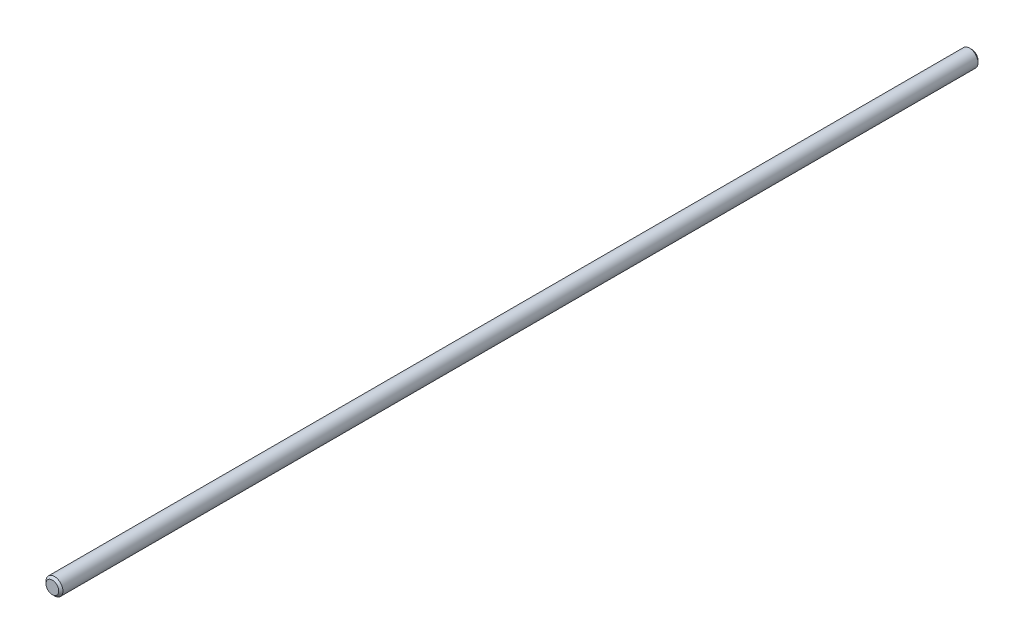
from build123d import *

# Parameters (mm, degrees)
SCHIZZO1_R                   = 4
ESTRUSIONE_ESTRUSIONE1_DEPTH = 435
SMUSSO1_SIZE                 = 1


with BuildPart() as part:
    # Schizzo1 → Estrusione-Estrusione1 (new body)
    with BuildSketch(Plane.XY):
        Circle(SCHIZZO1_R)
    extrude(amount=ESTRUSIONE_ESTRUSIONE1_DEPTH)

    # Smusso1
    smusso1_edges = [part.edges().sort_by_distance(p)[0] for p in [
        (-4, 0, 0),
        (-4, 0, 435),
    ]]
    chamfer(smusso1_edges, length=SMUSSO1_SIZE)


solid = part.part
